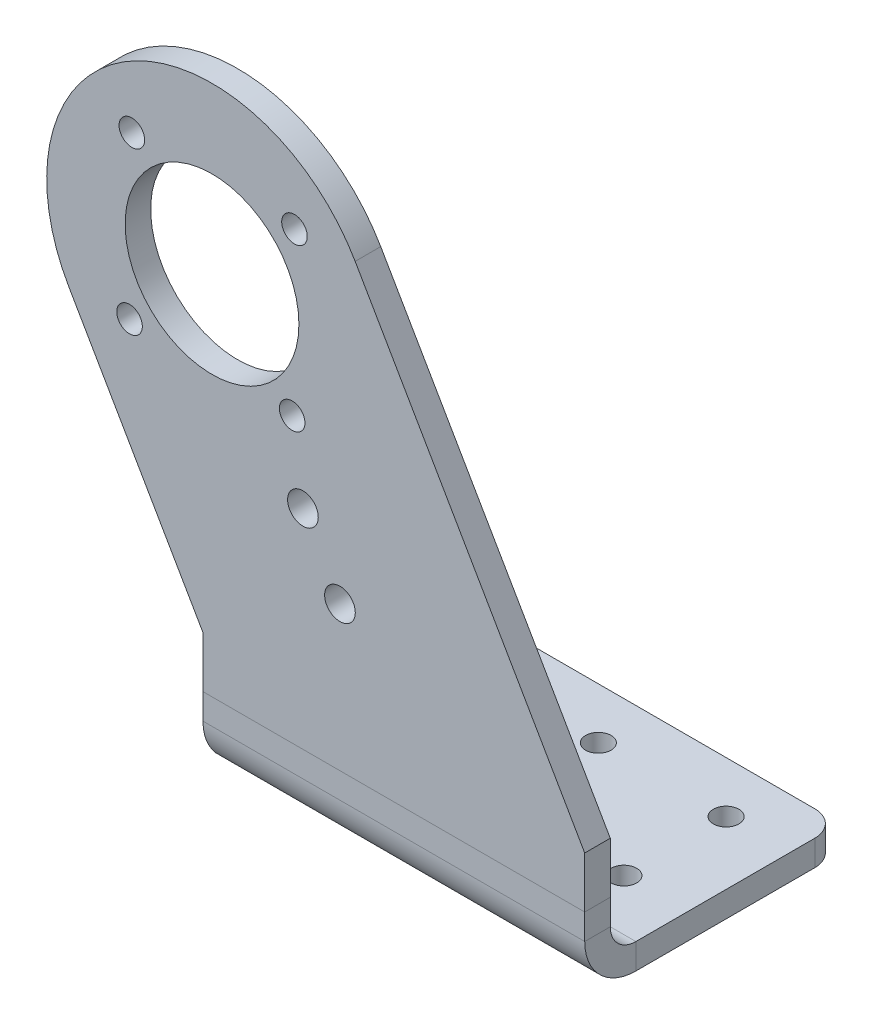
from build123d import *

# Parameters (mm, degrees)
SKETCH_1_R             = 17
SKETCH_1_R_2           = 2.5
SKETCH_1_R_3           = 3
EXTRUDE_1_DEPTH        = 5
SM_BASE_FLANGE_1_DEPTH = 74.681955
SKETCH_8_R             = 2.5
CUT_EXTRUDE_1_DEPTH    = 134.765093758
FILLET_1_R             = 5


# Sheet-metal steps are written as plain solids
with BuildPart() as part:
    # Sketch 1 → 凸台-拉伸1 (new body)
    with BuildSketch(Plane.XY):
        with BuildLine():
            Line((-49.360062144, -0.241015089), (-23.122201524, -45.686322765))
            Line((-23.122201524, -45.686322765), (-23.122201524, -55.686322765))
            Line((-23.122201524, -55.686322765), (51.559753885, -55.686322765))
            Line((51.559753885, -55.686322765), (51.559753885, -45.686322765))
            Line((51.559753885, -45.686322765), (6.651404412, 32.097220205))
            ThreePointArc((6.651404412, 32.097220205), (-37.523446513, 43.933835837), (-49.360062144, -0.241015089))
        make_face()
        with Locations((-21.354328866, 15.928102558)):
            Circle(SKETCH_1_R, mode=Mode.SUBTRACT)
        with Locations((-37.038190861, 32.060878913)):
            Circle(SKETCH_1_R_2, mode=Mode.SUBTRACT)
        with Locations((-3.567776343, -14.879110103)):
            Circle(SKETCH_1_R_3, mode=Mode.SUBTRACT)
        with Locations((3.675910259, -27.425543331)):
            Circle(SKETCH_1_R_3, mode=Mode.SUBTRACT)
        with Locations((-5.221552511, 31.611964554)):
            Circle(SKETCH_1_R_2, mode=Mode.SUBTRACT)
        with Locations((-5.670466871, -0.204673796)):
            Circle(SKETCH_1_R_2, mode=Mode.SUBTRACT)
        with Locations((-37.487105221, 0.244240563)):
            Circle(SKETCH_1_R_2, mode=Mode.SUBTRACT)
    extrude(amount=EXTRUDE_1_DEPTH)


with BuildPart() as body_2:
    # 草图3 → 基体-法兰1 (new body)
    with BuildSketch(Plane(origin=(51.559753885, 0, 0), x_dir=(0, 0, -1), z_dir=(1, 0, 0))):
        with BuildLine():
            Line((0, -55.686322765), (0, -60.686322765))
            ThreePointArc((0, -60.686322765), (1.464466094, -64.221856671), (5, -65.686322765))
            Line((5, -65.686322765), (45, -65.686322765))
            Line((45, -65.686322765), (45, -70.686322765))
            Line((45, -70.686322765), (5, -70.686322765))
            ThreePointArc((5, -70.686322765), (-2.071067812, -67.757390577), (-5, -60.686322765))
            Line((-5, -60.686322765), (-5, -55.686322765))
            Line((-5, -55.686322765), (0, -55.686322765))
        make_face()
    extrude(amount=-SM_BASE_FLANGE_1_DEPTH)

    # 草图8 → 切除-拉伸1 (cut, through all)
    with BuildSketch(Plane(origin=(0, -65.686322765, 0), x_dir=(1, 0, 0), z_dir=(0, 1, 0))):
        with Locations(Location((14.21877618, 35, 0), (0, 0, 180))):
            Circle(SKETCH_8_R)
        with Locations(Location((-10.78122382, 35, 0), (0, 0, 180))):
            Circle(SKETCH_8_R)
        with Locations(Location((-10.78122382, 15, 0), (0, 0, 180))):
            Circle(SKETCH_8_R)
        with Locations(Location((14.21877618, 15, 0), (0, 0, 180))):
            Circle(SKETCH_8_R)
        with Locations((39.21877618, 15)):
            Circle(SKETCH_8_R)
        with Locations((39.21877618, 35)):
            Circle(SKETCH_8_R)
    extrude(amount=-CUT_EXTRUDE_1_DEPTH, mode=Mode.SUBTRACT)

    # 圆角1
    fillet_1_edges = [body_2.edges().sort_by_distance(p)[0] for p in [
        (-23.122201115, -68.186322765, -45),
        (51.559753885, -68.186322765, -45),
    ]]
    fillet(fillet_1_edges, radius=FILLET_1_R)


solid = Compound([part.part, body_2.part])
